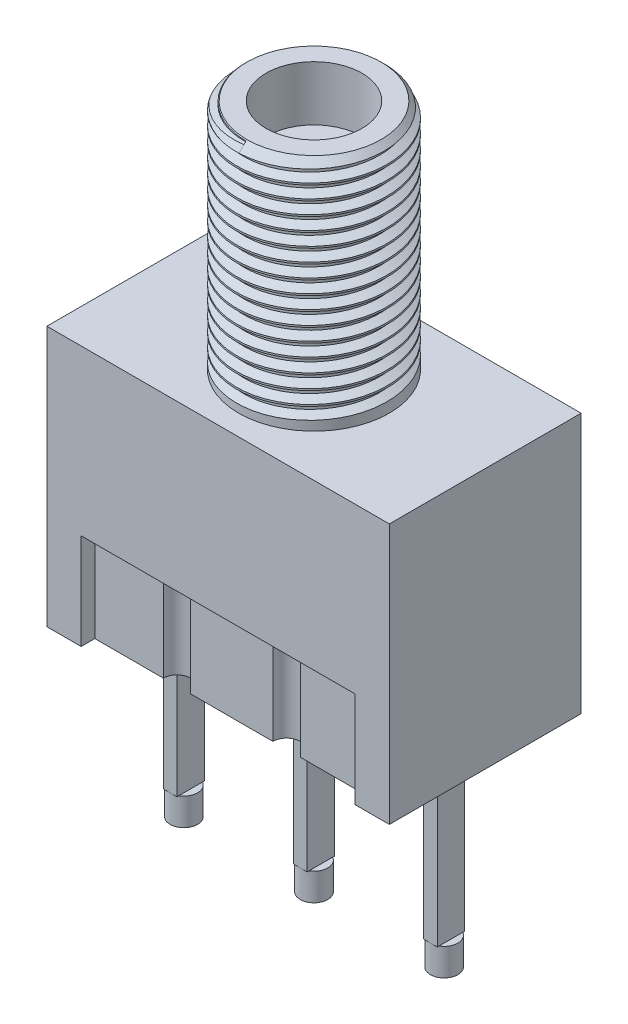
from build123d import *

# Parameters (mm, degrees)
SKETCH1_W              = 12.5
SKETCH1_H              = 7
BOSS_EXTRUDE1_DEPTH    = 9.5
CUT_EXTRUDE1_DEPTH     = 3.5
SKETCH3_W              = 1
SKETCH3_H              = 3
BOSS_EXTRUDE2_DEPTH    = 1
SKETCH4_W              = 0.5
SKETCH4_H              = 1
BOSS_EXTRUDE3_DEPTH    = 6
SKETCH5_R              = 2.75
BOSS_EXTRUDE4_DEPTH    = 8.5
CHAMFER1_SIZE          = 0.3
CUT_SWEEP2_PITCH       = 0.5
CUT_SWEEP2_HEIGHT      = 8.125
CUT_SWEEP2_RADIUS      = 2.4795
CUT_SWEEP2_START_ANGLE = 180
CUT_EXTRUDE2_DEPTH     = 2.8
SKETCH11_R             = 1.75
CUT_EXTRUDE3_DEPTH     = 2
SKETCH15_R             = 0.5
BOSS_EXTRUDE5_DEPTH    = 1


with BuildPart() as part:
    # Sketch1 → Boss-Extrude1 (new body)
    with BuildSketch(Plane(origin=(0, 0, 0), x_dir=(1, 0, 0), z_dir=(0, 1, 0))):
        with Locations((0, 0.408667973)):
            Rectangle(SKETCH1_W, SKETCH1_H)
    extrude(amount=BOSS_EXTRUDE1_DEPTH)

    # Sketch2 → Cut-Extrude1 (cut)
    with BuildSketch(Plane.XZ):
        with BuildLine():
            Line((-5, 3.091332027), (5, 3.091332027))
            Line((5, 3.091332027), (5, 2.591332027))
            Line((5, 2.591332027), (2.5, 2.591332027))
            ThreePointArc((2.5, 2.591332027), (2, 2.091332027), (1.5, 2.591332027))
            Line((1.5, 2.591332027), (-1.5, 2.591332027))
            ThreePointArc((-1.5, 2.591332027), (-2, 2.091332027), (-2.5, 2.591332027))
            Line((-2.5, 2.591332027), (-5, 2.591332027))
            Line((-5, 2.591332027), (-5, 3.091332027))
        make_face()
        with BuildLine():
            Line((-5, -3.908667973), (5, -3.908667973))
            Line((5, -3.908667973), (5, -3.408667973))
            Line((5, -3.408667973), (2.5, -3.408667973))
            ThreePointArc((2.5, -3.408667973), (2, -2.908667973), (1.5, -3.408667973))
            Line((1.5, -3.408667973), (-1.5, -3.408667973))
            ThreePointArc((-1.5, -3.408667973), (-2, -2.908667973), (-2.5, -3.408667973))
            Line((-2.5, -3.408667973), (-5, -3.408667973))
            Line((-5, -3.408667973), (-5, -3.908667973))
        make_face()
    extrude(amount=-CUT_EXTRUDE1_DEPTH, mode=Mode.SUBTRACT)

    # Sketch3 → Boss-Extrude2 (add)
    with BuildSketch(Plane.XZ):
        with Locations((-2, -0.408667973)):
            Rectangle(SKETCH3_W, SKETCH3_H)
        with Locations((2, -0.408667973)):
            Rectangle(SKETCH3_W, SKETCH3_H)
    extrude(amount=BOSS_EXTRUDE2_DEPTH)

    # Sketch4 → Boss-Extrude3 (add)
    with BuildSketch(Plane.XZ):
        with Locations((-4.75, -0.408667973)):
            Rectangle(SKETCH4_W, SKETCH4_H)
        with Locations((4.75, -0.408667973)):
            Rectangle(SKETCH4_W, SKETCH4_H)
        with Locations((0, -0.408667973)):
            Rectangle(SKETCH4_W, SKETCH4_H)
    extrude(amount=BOSS_EXTRUDE3_DEPTH)

    # Sketch5 → Boss-Extrude4 (add)
    with BuildSketch(Plane(origin=(0, 9.5, 0), x_dir=(1, 0, 0), z_dir=(0, 1, 0))):
        with Locations((0, 0.408667973)):
            Circle(SKETCH5_R)
    extrude(amount=BOSS_EXTRUDE4_DEPTH)

    # Chamfer1
    chamfer1_edges = [part.edges().sort_by_distance(p)[0] for p in [
        (-2.75, 18, -0.408667973),
    ]]
    chamfer(chamfer1_edges, length=CHAMFER1_SIZE)

    # Cut-Sweep2: sweep along a helix
    with BuildLine() as cut_sweep2_path:
        add(Helix(CUT_SWEEP2_PITCH, CUT_SWEEP2_HEIGHT, CUT_SWEEP2_RADIUS, center=(0, 18, -0.408667973), direction=(0, -1, 0), mode=Mode.PRIVATE).rotate(Axis((0, 18, -0.408667973), (0, -1, 0)), CUT_SWEEP2_START_ANGLE))
    # Sketch8 → Cut-Sweep2 (sweep, cut)
    with BuildSketch(Plane(origin=(0, 0, 0), x_dir=(0, 0, -1), z_dir=(1, 0, 0))):
        Polygon((-2.070832027, 18.062500332), (-2.341457027, 18.218745748), (-2.591888811, 18.218745748), (-2.591888811, 17.781254252), (-2.341457027, 17.781254252), (-2.070832027, 17.937499668), align=None)
    sweep(path=cut_sweep2_path.line, is_frenet=True, mode=Mode.SUBTRACT)

    # Sketch9 → Cut-Extrude2 (cut)
    with BuildSketch(Plane.XY.offset(-0.408667973)):
        Polygon((-2.7500625, 10.093709664), (-2.7500625, 9.656254252), (-2.4795, 9.812499668), (-2.4795, 9.937500332), align=None)
    extrude(amount=-CUT_EXTRUDE2_DEPTH, mode=Mode.SUBTRACT)

    # Sketch11 → Cut-Extrude3 (cut)
    with BuildSketch(Plane(origin=(0, 18, 0), x_dir=(1, 0, 0), z_dir=(0, 1, 0))):
        with Locations((0, 0.408667973)):
            Circle(SKETCH11_R)
    extrude(amount=-CUT_EXTRUDE3_DEPTH, mode=Mode.SUBTRACT)

    # Sketch15 → Boss-Extrude5 (add)
    with BuildSketch(Plane.XZ.offset(6)):
        with Locations((0, -0.408667973)):
            Circle(SKETCH15_R)
        with Locations((4.75, -0.408667973)):
            Circle(SKETCH15_R)
        with Locations((-4.75, -0.408667973)):
            Circle(SKETCH15_R)
    extrude(amount=BOSS_EXTRUDE5_DEPTH)


solid = part.part
